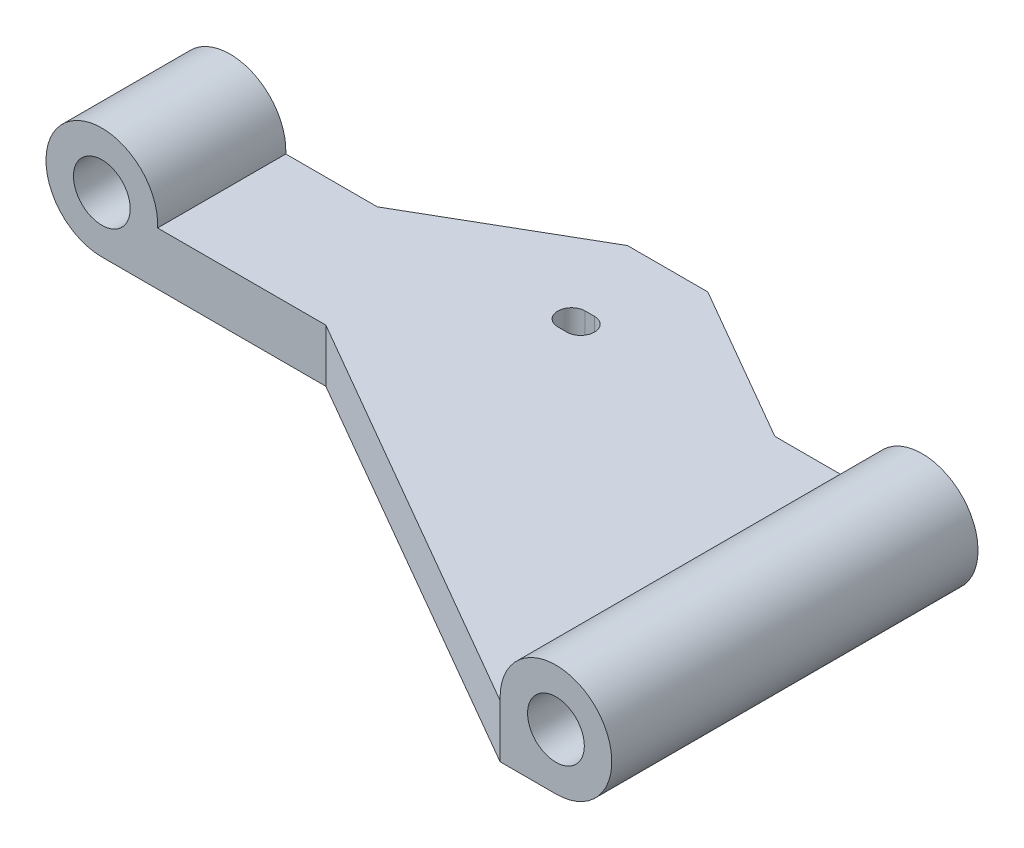
from build123d import *

# Parameters (mm, degrees)
SKETCH_2_R                = 1.55
EXTRUDE_1_DEPTH           = 25
CUT_EXTRUDE_3_DEPTH       = 74.430746455
SKETCH_8_R                = 1.6
CUT_EXTRUDE_4_DEPTH       = 0.8
CUT_EXTRUDE_10_DEPTH      = 74.430746455
CUT_EXTRUDE_10_DEPTH_BACK = 74.430746455


with BuildPart() as part:
    # 草图2 → 凸台-拉伸1 (new body)
    with BuildSketch(Plane.XY.offset(70)):
        with BuildLine():
            Line((15.853941071, 15.6), (-15.853941071, 15.6))
            ThreePointArc((-15.853941071, 15.6), (-21.001160394, 17.965797367), (-18.9, 12.705))
            Line((-18.9, 12.705), (18.9, 12.705))
            ThreePointArc((18.9, 12.705), (21.001160394, 17.965797367), (15.853941071, 15.6))
        make_face()
        with Locations((18.9, 15.755)):
            Circle(SKETCH_2_R, mode=Mode.SUBTRACT)
        with Locations((-18.9, 15.755)):
            Circle(SKETCH_2_R, mode=Mode.SUBTRACT)
    extrude(amount=-EXTRUDE_1_DEPTH)

    # 草图7 → 切除-拉伸3 (cut, through all)
    with BuildSketch(Plane(origin=(0, 15.6, 0), x_dir=(1, 0, 0), z_dir=(0, 1, 0))):
        with BuildLine():
            Line((0.25, -50.75), (-0.25, -50.75))
            ThreePointArc((-0.25, -50.75), (-1, -50), (-0.25, -49.25))
            Line((-0.25, -49.25), (0.25, -49.25))
            ThreePointArc((0.25, -49.25), (1, -50), (0.25, -50.75))
        make_face()
    extrude(amount=-CUT_EXTRUDE_3_DEPTH, mode=Mode.SUBTRACT)

    # 草图8 → 切除-拉伸4 (cut)
    with BuildSketch(Plane.XZ.offset(-12.705)):
        with Locations((0, 50)):
            Circle(SKETCH_8_R)
    extrude(amount=-CUT_EXTRUDE_4_DEPTH, mode=Mode.SUBTRACT)

    # 草图11 → 切除-拉伸10 (cut, two sides: drawn at the far end of the back side and taken through both)
    with BuildSketch(Plane(origin=(0, 15.6, 0), x_dir=(1, 0, 0), z_dir=(0, 1, 0)).offset(-CUT_EXTRUDE_10_DEPTH_BACK)):
        Polygon((-6.666660498, -57), (-21.95, -57), (-21.95, -70), (15.85, -70), align=None)
        Polygon((-21.95, -50), (-10.853941071, -50), (-2.193687033, -45), (-21.95, -45), align=None)
        Polygon((10.853941071, -50), (21.95, -50), (21.95, -45), (2.193687033, -45), align=None)
    extrude(amount=CUT_EXTRUDE_10_DEPTH + CUT_EXTRUDE_10_DEPTH_BACK, mode=Mode.SUBTRACT)


solid = part.part
